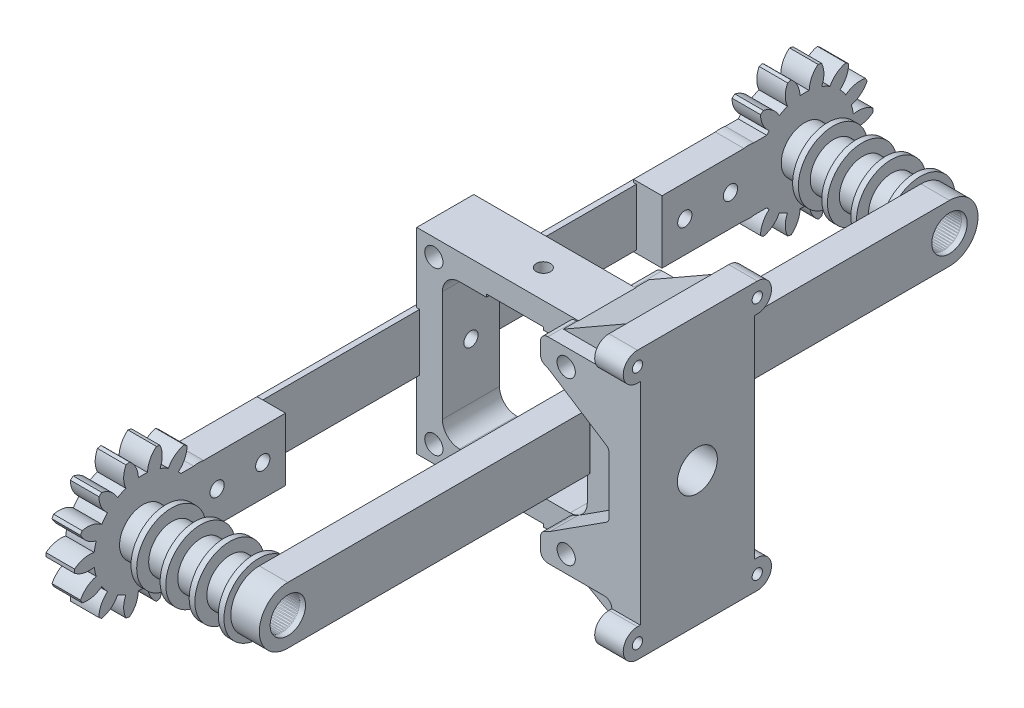
from build123d import *
from build123d.topology import SkipClean

# Parameters (mm, degrees)
BASPROSKE_W              = 5
BASPROSKE_H              = 12
TOOTHCUT_DEPTH           = 18.691806013
TEETHCUTS_COUNT          = 14
TEETHCUTS_ANGLE          = 334.285714286
BORSKE_R                 = 3.1
BORE_DEPTH               = 50.0000508
SKETCH_2_W               = 20
SKETCH_2_H               = 11
EXTRUDE_1_DEPTH          = 5
SKETCH_3_W               = 17
SKETCH_3_H               = 10
CUT_EXTRUDE_1_DEPTH      = 0.5
SKETCH_5_W               = 10
SKETCH_5_H               = 10
SKETCH_5_W_2             = 8
SKETCH_5_H_2             = 8
EXTRUDE_2_DEPTH          = 50
SKETCH_12_W              = 9
SKETCH_12_H              = 10
CUT_EXTRUDE_4_DEPTH      = 73.447820449
CUT_EXTRUDE_2_DEPTH      = 60.436408773
CUT_EXTRUDE_2_DEPTH_BACK = 60.436408773
SKETCH_4_R               = 1.25
SKETCH_7_R               = 4.1
SKETCH_7_R_2             = 3.1
EXTRUDE_3_DEPTH          = 4
PATTERN_LINEAR_1_COUNT   = 5
PATTERN_LINEAR_1_PITCH   = 5.1
SKETCH_14_R              = 3.1
EXTRUDE_5_DEPTH          = 1
SKETCH_15_W              = 34.4
SKETCH_15_H              = 34.4
SKETCH_15_R              = 1.6
EXTRUDE_6_DEPTH          = 5
SKETCH_17_R              = 6.1
SKETCH_17_R_2            = 3.1
EXTRUDE_8_DEPTH          = 1
PATTERN_LINEAR_3_COUNT   = 4
PATTERN_LINEAR_3_PITCH   = 5.1
PATTERN_LINEAR_2_COUNT   = 2
PATTERN_LINEAR_2_PITCH   = 100
MOVE_BODY_2_ANGLE        = 180
MOVE_BODY_2_2_ANGLE      = 180
MOVE_BODY_2_3_ANGLE      = 180
MOVE_BODY_2_4_ANGLE      = 180
MOVE_BODY_2_5_ANGLE      = 180
MOVE_BODY_2_6_ANGLE      = 180
MOVE_BODY_2_7_ANGLE      = 180
MOVE_BODY_2_8_ANGLE      = 180
MOVE_BODY_2_9_ANGLE      = 180
MOVE_BODY_2_10_ANGLE     = 180
MOVE_BODY_2_11_ANGLE     = 180
MOVE_BODY_2_12_ANGLE     = 180
MOVE_BODY_2_13_ANGLE     = 180
CUT_EXTRUDE_5_DEPTH      = 78.959284245
CUT_EXTRUDE_5_DEPTH_BACK = 78.959284245
SKETCH_16_W              = 10
SKETCH_16_H              = 1
SKETCH_16_W_2            = 1
SKETCH_16_H_2            = 10
EXTRUDE_START            = -5
EXTRUDE_7_OUTLINE_W      = 1
EXTRUDE_7_OUTLINE_H      = 10
EXTRUDE_7_DEPTH          = 5
EXTRUDE_7_2_OUTLINE_W    = 1
EXTRUDE_7_2_OUTLINE_H    = 10
EXTRUDE_7_2_DEPTH        = 5
EXTRUDE_7_3_OUTLINE_W    = 10
EXTRUDE_7_3_OUTLINE_H    = 1
EXTRUDE_7_3_DEPTH        = 5
EXTRUDE_7_4_OUTLINE_W    = 10
EXTRUDE_7_4_OUTLINE_H    = 1
EXTRUDE_7_4_DEPTH        = 5
SKETCH_21_R              = 1.25
CUT_EXTRUDE_6_DEPTH      = 134.848048174
SKETCH_22_R              = 1.25
CUT_EXTRUDE_7_DEPTH      = 136.891022514
SKETCH_23_R              = 1.6
CUT_EXTRUDE_8_DEPTH      = 134.848048174
SKETCH_24_R              = 1.6
CUT_EXTRUDE_9_DEPTH      = 136.891022514
SKETCH_25_R              = 1.6
EXTRUDE_9_DEPTH          = 10
EXTRUDE_10_DEPTH         = 5
SKETCH_26_R              = 0.9
SKETCH_26_R_2            = 3.5
CUT_EXTRUDE_10_DEPTH     = 138.504945366
EXTRUDE_11_DEPTH         = 7.5
OTHER_START              = -63.1
OTHER_2_OUTLINE_R        = 1.6
OTHER_2_DEPTH            = 10.2
OTHER_START_2            = -63.2
OTHER_2_2_OUTLINE_R      = 1.5
OTHER_2_2_OUTLINE_R_2    = 1.4
OTHER_2_2_DEPTH          = 10.4
OTHER_2_3_OUTLINE_R      = 1.6
OTHER_2_3_OUTLINE_R_2    = 1.5
OTHER_2_3_DEPTH          = 0.1
OTHER_START_3            = -52.9
OTHER_2_4_OUTLINE_R      = 1.6
OTHER_2_4_OUTLINE_R_2    = 1.5
OTHER_2_4_DEPTH          = 0.1
MOVE_BODY_4_ANGLE        = 180
MOVE_BODY_4_2_ANGLE      = 180
MOVE_BODY_4_3_ANGLE      = 180
MOVE_BODY_4_4_ANGLE      = 180
MOVE_BODY_4_5_ANGLE      = 180
MOVE_BODY_4_6_ANGLE      = 180
MOVE_BODY_4_7_ANGLE      = 180
MOVE_BODY_4_8_ANGLE      = 180
MOVE_BODY_4_9_ANGLE      = 180
MOVE_BODY_4_10_ANGLE     = 180
MOVE_BODY_4_11_ANGLE     = 180
MOVE_BODY_4_12_ANGLE     = 180
MOVE_BODY_4_13_ANGLE     = 180
MOVE_BODY_4_14_ANGLE     = 180
MOVE_BODY_4_15_ANGLE     = 180
MOVE_BODY_4_16_ANGLE     = 180
MOVE_BODY_4_17_ANGLE     = 180
MOVE_BODY_4_18_ANGLE     = 180
MOVE_BODY_4_19_ANGLE     = 180
MOVE_BODY_4_20_ANGLE     = 180
MOVE_BODY_4_21_ANGLE     = 180
MOVE_BODY_4_22_ANGLE     = 180
MOVE_BODY_4_23_ANGLE     = 180
SKETCH_29_R              = 1.5
CUT_EXTRUDE_11_DEPTH     = 10.2
EXTRUDE_START_2          = -4
SKETCH_30_R              = 3.25
SKETCH_30_R_2            = 3.1
EXTRUDE_12_DEPTH         = 4
OTHER_START_4            = 0.95
OTHER_3_OUTLINE_W        = 10
OTHER_3_OUTLINE_H        = 10.3
OTHER_3_OUTLINE_R        = 1.6
OTHER_3_DEPTH            = 0.15
OTHER_START_5            = 0.45
OTHER_3_2_OUTLINE_W      = 0.15
OTHER_3_2_OUTLINE_H      = 10.3
OTHER_3_2_DEPTH          = 0.5


with BuildPart() as part:
    # BasProSke → Base-Revolve (revolve)
    with BuildSketch(Plane(origin=(0, 0, 0), x_dir=(1, 0, 0), z_dir=(0, 1, 0)), mode=Mode.PRIVATE) as base_revolve_sk:
        with Locations((2.5, 6)):
            Rectangle(BASPROSKE_W, BASPROSKE_H)
    revolve(base_revolve_sk.sketch.rotate(Axis((-10, 0, 0), (1, 0, 0)), 180), axis=Axis((-10, 0, 0), (1, 0, 0)))

    # TooCutSke → ToothCut (cut, through all)
    with BuildSketch(Plane(origin=(0, 0, 0), x_dir=(0, 0, -1), z_dir=(1, 0, 0))):
        with BuildLine():
            ThreePointArc((0.804845511, 8.586361261), (0, 8.624), (-0.804845511, 8.586361261))
            ThreePointArc((-0.804845511, 8.586361261), (-1.237812142, 10.362618414), (-2.384428228, 11.78663426))
            ThreePointArc((-2.384428228, 11.78663426), (0, 12.0254), (2.384428228, 11.78663426))
            ThreePointArc((2.384428228, 11.78663426), (1.237812142, 10.362618414), (0.804845511, 8.586361261))
        make_face()
    toothcut = extrude(amount=TOOTHCUT_DEPTH, mode=Mode.SUBTRACT)

    # TeethCuts: ToothCut ×14 about axis
    teethcuts_axis = Axis((-10, 0, 0), (1, 0, 0))
    for i in range(1, TEETHCUTS_COUNT):
        add(toothcut.rotate(teethcuts_axis, i * TEETHCUTS_ANGLE / (TEETHCUTS_COUNT - 1)), mode=Mode.SUBTRACT)

    # BorSke → Bore (cut, symmetric)
    with BuildSketch(Plane(origin=(0, 0, 0), x_dir=(0, 0, -1), z_dir=(1, 0, 0))):
        with Locations(Location((0, 0, 0), (0, 0, 180))):
            Circle(BORSKE_R)
    extrude(amount=BORE_DEPTH, both=True, mode=Mode.SUBTRACT)

    # ｽｹｯﾁ2 → ﾎﾞｽ - 押し出し1 (add)
    with BuildSketch(Plane(origin=(5, 0, 0), x_dir=(0, 0, -1), z_dir=(1, 0, 0))):
        with Locations((15, 0)):
            Rectangle(SKETCH_2_W, SKETCH_2_H)
    extrude(amount=-EXTRUDE_1_DEPTH)

    # ｽｹｯﾁ3 → ｶｯﾄ - 押し出し1 (cut)
    with BuildSketch(Plane(origin=(5, 0, 0), x_dir=(0, 0, -1), z_dir=(1, 0, 0))):
        with Locations((16.5, 0)):
            Rectangle(SKETCH_3_W, SKETCH_3_H)
    extrude(amount=-CUT_EXTRUDE_1_DEPTH, mode=Mode.SUBTRACT)

    # ｽｹｯﾁ4 → ｶｯﾄ - 押し出し2 (cut, two sides: drawn at the far end of the back side and taken through both)
    with BuildSketch(Plane.ZY.offset(-CUT_EXTRUDE_2_DEPTH_BACK)):
        with Locations(Location((-21, 0, 0), (0, 0, 180))):
            Circle(SKETCH_4_R)
        with Locations(Location((-13, 0, 0), (0, 0, 180))):
            Circle(SKETCH_4_R)
    extrude(amount=CUT_EXTRUDE_2_DEPTH + CUT_EXTRUDE_2_DEPTH_BACK, mode=Mode.SUBTRACT)


with BuildPart() as body_2:
    # ｽｹｯﾁ5 → ﾎﾞｽ - 押し出し2 (new body)
    with BuildSketch(Plane(origin=(0, 0, -8), x_dir=(-1, 0, 0), z_dir=(0, 0, -1))):
        with Locations((-9.5, 0)):
            Rectangle(SKETCH_5_W, SKETCH_5_H)
        with Locations((-9.5, 0)):
            Rectangle(SKETCH_5_W_2, SKETCH_5_H_2, mode=Mode.SUBTRACT)
    extrude(amount=EXTRUDE_2_DEPTH)

    # ｽｹｯﾁ12 → ｶｯﾄ - 押し出し4 (cut, through all)
    with BuildSketch(Plane(origin=(0, 0, -58), x_dir=(-1, 0, 0), z_dir=(0, 0, -1))):
        with Locations((-10, 0)):
            Rectangle(SKETCH_12_W, SKETCH_12_H)
    extrude(amount=-CUT_EXTRUDE_4_DEPTH, mode=Mode.SUBTRACT)


with BuildPart() as body_3:
    # ｽｹｯﾁ7 → ﾎﾞｽ - 押し出し3 (new body)
    with BuildSketch(Plane.ZY):
        Circle(SKETCH_7_R)
        Circle(SKETCH_7_R_2, mode=Mode.SUBTRACT)
    extrude(amount=EXTRUDE_3_DEPTH)


with BuildPart() as pattern_linear_1_1:
    # 直線ﾊﾟﾀｰﾝ1: pattern copy
    add(body_3.part.moved(Location(Vector(-1, 0, 0) * (1 * PATTERN_LINEAR_1_PITCH))))


with BuildPart() as pattern_linear_1_2:
    # 直線ﾊﾟﾀｰﾝ1: pattern copy
    add(body_3.part.moved(Location(Vector(-1, 0, 0) * (2 * PATTERN_LINEAR_1_PITCH))))


with BuildPart() as pattern_linear_1_3:
    # 直線ﾊﾟﾀｰﾝ1: pattern copy
    add(body_3.part.moved(Location(Vector(-1, 0, 0) * (3 * PATTERN_LINEAR_1_PITCH))))


with BuildPart() as pattern_linear_1_4:
    # 直線ﾊﾟﾀｰﾝ1: pattern copy
    add(body_3.part.moved(Location(Vector(-1, 0, 0) * (4 * PATTERN_LINEAR_1_PITCH))))


with BuildPart() as body_8:
    # ｽｹｯﾁ14 → ﾎﾞｽ - 押し出し5 (new body)
    with BuildSketch(Plane.ZY.offset(24.4)):
        with BuildLine():
            Line((-58, 5), (0, 5))
            ThreePointArc((0, 5), (5, 0), (0, -5))
            Line((0, -5), (-58, -5))
            Line((-58, -5), (-58, 5))
        make_face()
        Circle(SKETCH_14_R, mode=Mode.SUBTRACT)
    extrude(amount=EXTRUDE_5_DEPTH)


with BuildPart() as body_9:
    # ｽｹｯﾁ15 → ﾎﾞｽ - 押し出し6 (new body)
    with BuildSketch(Plane(origin=(0, 0, -58), x_dir=(-1, 0, 0), z_dir=(0, 0, -1))):
        with Locations((12.2, 0)):
            Rectangle(SKETCH_15_W, SKETCH_15_H)
        with Locations(Location((26.4, 14.2, 0), (0, 0, 90))):
            Circle(SKETCH_15_R, mode=Mode.SUBTRACT)
        with Locations(Location((26.4, -14.2, 0), (0, 0, 90))):
            Circle(SKETCH_15_R, mode=Mode.SUBTRACT)
        with Locations(Location((-2, -14.2, 0), (0, 0, 90))):
            Circle(SKETCH_15_R, mode=Mode.SUBTRACT)
        with Locations(Location((-2, 14.2, 0), (0, 0, 90))):
            Circle(SKETCH_15_R, mode=Mode.SUBTRACT)
        with BuildLine():
            Line((21.9, -12.7), (2.5, -12.7))
            ThreePointArc((2.5, -12.7), (0.378679656, -11.821320344), (-0.5, -9.7))
            Line((-0.5, -9.7), (-0.5, 9.7))
            ThreePointArc((-0.5, 9.7), (0.378679656, 11.821320344), (2.5, 12.7))
            Line((2.5, 12.7), (21.9, 12.7))
            ThreePointArc((21.9, 12.7), (24.021320344, 11.821320344), (24.9, 9.7))
            Line((24.9, 9.7), (24.9, -9.7))
            ThreePointArc((24.9, -9.7), (24.021320344, -11.821320344), (21.9, -12.7))
        make_face(mode=Mode.SUBTRACT)
    extrude(amount=-EXTRUDE_6_DEPTH)


with BuildPart() as body_10:
    # ｽｹｯﾁ17 → ﾎﾞｽ - 押し出し8 (new body)
    with BuildSketch(Plane.ZY.offset(4)):
        Circle(SKETCH_17_R)
        Circle(SKETCH_17_R_2, mode=Mode.SUBTRACT)
    extrude(amount=EXTRUDE_8_DEPTH)


with BuildPart() as pattern_linear_3_1:
    # 直線ﾊﾟﾀｰﾝ3: pattern copy
    add(body_10.part.moved(Location(Vector(-1, 0, 0) * (1 * PATTERN_LINEAR_3_PITCH))))


with BuildPart() as pattern_linear_3_2:
    # 直線ﾊﾟﾀｰﾝ3: pattern copy
    add(body_10.part.moved(Location(Vector(-1, 0, 0) * (2 * PATTERN_LINEAR_3_PITCH))))


with BuildPart() as pattern_linear_3_3:
    # 直線ﾊﾟﾀｰﾝ3: pattern copy
    add(body_10.part.moved(Location(Vector(-1, 0, 0) * (3 * PATTERN_LINEAR_3_PITCH))))


with BuildPart() as pattern_linear_2_1:
    # 直線ﾊﾟﾀｰﾝ2: pattern copy
    add(body_10.part.moved(Location(Vector(0, 0, -1) * (1 * PATTERN_LINEAR_2_PITCH))))


with BuildPart() as pattern_linear_2_2:
    # 直線ﾊﾟﾀｰﾝ2: pattern copy
    add(pattern_linear_3_1.part.moved(Location(Vector(0, 0, -1) * (1 * PATTERN_LINEAR_2_PITCH))))


with BuildPart() as pattern_linear_2_3:
    # 直線ﾊﾟﾀｰﾝ2: pattern copy
    add(pattern_linear_3_2.part.moved(Location(Vector(0, 0, -1) * (1 * PATTERN_LINEAR_2_PITCH))))


with BuildPart() as pattern_linear_2_4:
    # 直線ﾊﾟﾀｰﾝ2: pattern copy
    add(pattern_linear_3_3.part.moved(Location(Vector(0, 0, -1) * (1 * PATTERN_LINEAR_2_PITCH))))


with BuildPart() as pattern_linear_2_5:
    # 直線ﾊﾟﾀｰﾝ2: pattern copy
    add(body_3.part.moved(Location(Vector(0, 0, -1) * (1 * PATTERN_LINEAR_2_PITCH))))


with BuildPart() as pattern_linear_2_6:
    # 直線ﾊﾟﾀｰﾝ2: pattern copy
    add(pattern_linear_1_1.part.moved(Location(Vector(0, 0, -1) * (1 * PATTERN_LINEAR_2_PITCH))))


with BuildPart() as pattern_linear_2_7:
    # 直線ﾊﾟﾀｰﾝ2: pattern copy
    add(body_9.part.moved(Location(Vector(0, 0, -1) * (1 * PATTERN_LINEAR_2_PITCH))))


with BuildPart() as pattern_linear_2_8:
    # 直線ﾊﾟﾀｰﾝ2: pattern copy
    add(pattern_linear_1_2.part.moved(Location(Vector(0, 0, -1) * (1 * PATTERN_LINEAR_2_PITCH))))


with BuildPart() as pattern_linear_2_9:
    # 直線ﾊﾟﾀｰﾝ2: pattern copy
    add(pattern_linear_1_3.part.moved(Location(Vector(0, 0, -1) * (1 * PATTERN_LINEAR_2_PITCH))))


with BuildPart() as pattern_linear_2_10:
    # 直線ﾊﾟﾀｰﾝ2: pattern copy
    add(body_2.part.moved(Location(Vector(0, 0, -1) * (1 * PATTERN_LINEAR_2_PITCH))))


with BuildPart() as pattern_linear_2_11:
    # 直線ﾊﾟﾀｰﾝ2: pattern copy
    add(part.part.moved(Location(Vector(0, 0, -1) * (1 * PATTERN_LINEAR_2_PITCH))))


with BuildPart() as pattern_linear_2_12:
    # 直線ﾊﾟﾀｰﾝ2: pattern copy
    add(pattern_linear_1_4.part.moved(Location(Vector(0, 0, -1) * (1 * PATTERN_LINEAR_2_PITCH))))


with BuildPart() as pattern_linear_2_13:
    # 直線ﾊﾟﾀｰﾝ2: pattern copy
    add(body_8.part.moved(Location(Vector(0, 0, -1) * (1 * PATTERN_LINEAR_2_PITCH))))


with BuildPart() as pattern_linear_2_2_1:
    # Move Body 2: read off the stored shape, not the designer's step
    # Move Body 2: moved
    add(pattern_linear_2_2.part.moved(Location((12.2, 12.2, 216))).rotate(Axis((0, 0, 0), (0.7071067812, -0.7071067812, 0)), MOVE_BODY_2_ANGLE))


with BuildPart() as pattern_linear_2_12_1:
    # Move Body 2 2: moved
    add(pattern_linear_2_12.part.moved(Location((12.2, 12.2, 216))).rotate(Axis((0, 0, 0), (0.7071067812, -0.7071067812, 0)), MOVE_BODY_2_2_ANGLE))


with BuildPart() as pattern_linear_2_9_1:
    # Move Body 2 3: moved
    add(pattern_linear_2_9.part.moved(Location((12.2, 12.2, 216))).rotate(Axis((0, 0, 0), (0.7071067812, -0.7071067812, 0)), MOVE_BODY_2_3_ANGLE))


with BuildPart() as pattern_linear_2_11_1:
    # Move Body 2 4: moved
    add(pattern_linear_2_11.part.moved(Location((12.2, 12.2, 216))).rotate(Axis((0, 0, 0), (0.7071067812, -0.7071067812, 0)), MOVE_BODY_2_4_ANGLE))


with BuildPart() as pattern_linear_2_3_1:
    # Move Body 2 5: moved
    add(pattern_linear_2_3.part.moved(Location((12.2, 12.2, 216))).rotate(Axis((0, 0, 0), (0.7071067812, -0.7071067812, 0)), MOVE_BODY_2_5_ANGLE))


with BuildPart() as pattern_linear_2_4_1:
    # Move Body 2 6: moved
    add(pattern_linear_2_4.part.moved(Location((12.2, 12.2, 216))).rotate(Axis((0, 0, 0), (0.7071067812, -0.7071067812, 0)), MOVE_BODY_2_6_ANGLE))


with BuildPart() as pattern_linear_2_5_1:
    # Move Body 2 7: moved
    add(pattern_linear_2_5.part.moved(Location((12.2, 12.2, 216))).rotate(Axis((0, 0, 0), (0.7071067812, -0.7071067812, 0)), MOVE_BODY_2_7_ANGLE))


with BuildPart() as pattern_linear_2_8_1:
    # Move Body 2 8: moved
    add(pattern_linear_2_8.part.moved(Location((12.2, 12.2, 216))).rotate(Axis((0, 0, 0), (0.7071067812, -0.7071067812, 0)), MOVE_BODY_2_8_ANGLE))


with BuildPart() as pattern_linear_2_6_1:
    # Move Body 2 9: moved
    add(pattern_linear_2_6.part.moved(Location((12.2, 12.2, 216))).rotate(Axis((0, 0, 0), (0.7071067812, -0.7071067812, 0)), MOVE_BODY_2_9_ANGLE))


with BuildPart() as pattern_linear_2_1_1:
    # Move Body 2 10: moved
    add(pattern_linear_2_1.part.moved(Location((12.2, 12.2, 216))).rotate(Axis((0, 0, 0), (0.7071067812, -0.7071067812, 0)), MOVE_BODY_2_10_ANGLE))


with BuildPart() as pattern_linear_2_13_1:
    # Move Body 2 11: moved
    add(pattern_linear_2_13.part.moved(Location((12.2, 12.2, 216))).rotate(Axis((0, 0, 0), (0.7071067812, -0.7071067812, 0)), MOVE_BODY_2_11_ANGLE))

    # Extrude 7 3 outline → Extrude 7 3 (add)
    with BuildSketch(Plane.XY.offset(-58)):
        with Locations((-12.2, 12.7)):
            Rectangle(EXTRUDE_7_3_OUTLINE_W, EXTRUDE_7_3_OUTLINE_H)
    extrude(amount=EXTRUDE_7_3_DEPTH)


with BuildPart() as pattern_linear_2_10_1:
    # Move Body 2 12: moved
    add(pattern_linear_2_10.part.moved(Location((12.2, 12.2, 216))).rotate(Axis((0, 0, 0), (0.7071067812, -0.7071067812, 0)), MOVE_BODY_2_12_ANGLE))

    # Extrude 7 4 outline → Extrude 7 4 (add)
    with BuildSketch(Plane.XY.offset(-58)):
        with Locations((-12.2, -17.2)):
            Rectangle(EXTRUDE_7_4_OUTLINE_W, EXTRUDE_7_4_OUTLINE_H)
    extrude(amount=EXTRUDE_7_4_DEPTH)


with BuildPart() as pattern_linear_2_7_1:
    # Move Body 2 13: moved
    add(pattern_linear_2_7.part.moved(Location((12.2, 12.2, 216))).rotate(Axis((0, 0, 0), (0.7071067812, -0.7071067812, 0)), MOVE_BODY_2_13_ANGLE))


with BuildPart() as cut_extrude_5_tool:
    # ｽｹｯﾁ16 → ｶｯﾄ - 押し出し5 (new, two sides: drawn at the far end of the back side and taken through both)
    with BuildSketch(Plane.XY.offset(-58).offset(-CUT_EXTRUDE_5_DEPTH_BACK)):
        with Locations((-12.2, -17.2)):
            Rectangle(SKETCH_16_W, SKETCH_16_H)
        with Locations((5, 0)):
            Rectangle(SKETCH_16_W_2, SKETCH_16_H_2)
        with Locations((-12.2, 12.7)):
            Rectangle(SKETCH_16_W, SKETCH_16_H)
        with Locations((-24.9, 0)):
            Rectangle(SKETCH_16_W_2, SKETCH_16_H_2)
    extrude(amount=CUT_EXTRUDE_5_DEPTH + CUT_EXTRUDE_5_DEPTH_BACK)


with BuildPart() as body_9_1:
    add(body_9.part)

    # ｶｯﾄ - 押し出し5: cut by cut_extrude_5_tool
    add(cut_extrude_5_tool.part, mode=Mode.SUBTRACT)


with BuildPart() as pattern_linear_2_7_2:
    add(pattern_linear_2_7_1.part)

    # ｶｯﾄ - 押し出し5: cut by cut_extrude_5_tool
    add(cut_extrude_5_tool.part, mode=Mode.SUBTRACT)


with BuildPart() as body_9_2:
    add(body_9_1.part)

    # Combine 1: union 直線ﾊﾟﾀｰﾝ2_7
    add(pattern_linear_2_7_2.part)

    # ｽｹｯﾁ21 → ｶｯﾄ - 押し出し6 (cut, through all)
    with SkipClean():  # the faces are left unmerged after this step: merging them gives an invalid solid
        with BuildSketch(Plane.ZY.offset(29.4)):
            with Locations((-58, 0)):
                Circle(SKETCH_21_R)
        extrude(amount=-CUT_EXTRUDE_6_DEPTH, mode=Mode.SUBTRACT)

    # ｽｹｯﾁ22 → ｶｯﾄ - 押し出し7 (cut, through all)
    with SkipClean():  # the faces are left unmerged after this step: merging them gives an invalid solid
        with BuildSketch(Plane.XZ.offset(17.7)):
            with Locations(Location((-12.2, -58, 0), (0, 0, 270))):
                Circle(SKETCH_22_R)
        extrude(amount=-CUT_EXTRUDE_7_DEPTH, mode=Mode.SUBTRACT)


with BuildPart() as body_8_1:
    add(body_8.part)

    # ﾎﾞｽ - 押し出し7: read off the stored shape, not the designer's step
    # ﾎﾞｽ - 押し出し7 outline → ﾎﾞｽ - 押し出し7 (add)
    with BuildSketch(Plane.XY.offset(-58).offset(EXTRUDE_START)):
        with Locations((-24.9, 0)):
            Rectangle(EXTRUDE_7_OUTLINE_W, EXTRUDE_7_OUTLINE_H)
    extrude(amount=EXTRUDE_7_DEPTH)


with BuildPart() as body_2_1:
    add(body_2.part)

    # Extrude 7 2 outline → Extrude 7 2 (add)
    with BuildSketch(Plane.XY.offset(-58).offset(EXTRUDE_START)):
        with Locations((5, 0)):
            Rectangle(EXTRUDE_7_2_OUTLINE_W, EXTRUDE_7_2_OUTLINE_H)
    extrude(amount=EXTRUDE_7_2_DEPTH)


with BuildPart() as cut_extrude_8_tool:
    # ｽｹｯﾁ23 → ｶｯﾄ - 押し出し8 (new, through all)
    with BuildSketch(Plane.ZY.offset(29.4)):
        with Locations(Location((-58, 0, 0), (0, 0, 180))):
            Circle(SKETCH_23_R)
    extrude(amount=-CUT_EXTRUDE_8_DEPTH)


with BuildPart() as body_2_2:
    add(body_2_1.part)

    # ｶｯﾄ - 押し出し8: cut by cut_extrude_8_tool
    add(cut_extrude_8_tool.part, mode=Mode.SUBTRACT)


with BuildPart() as body_8_2:
    add(body_8_1.part)

    # ｶｯﾄ - 押し出し8: cut by cut_extrude_8_tool
    add(cut_extrude_8_tool.part, mode=Mode.SUBTRACT)


with BuildPart() as cut_extrude_9_tool:
    # ｽｹｯﾁ24 → ｶｯﾄ - 押し出し9 (new, through all)
    with BuildSketch(Plane(origin=(0, 17.2, 0), x_dir=(1, 0, 0), z_dir=(0, 1, 0))):
        with Locations((-12.2, 58)):
            Circle(SKETCH_24_R)
    extrude(amount=-CUT_EXTRUDE_9_DEPTH)


with BuildPart() as pattern_linear_2_13_2:
    add(pattern_linear_2_13_1.part)

    # ｶｯﾄ - 押し出し9: cut by cut_extrude_9_tool
    add(cut_extrude_9_tool.part, mode=Mode.SUBTRACT)


with BuildPart() as pattern_linear_2_10_2:
    add(pattern_linear_2_10_1.part)

    # ｶｯﾄ - 押し出し9: cut by cut_extrude_9_tool
    add(cut_extrude_9_tool.part, mode=Mode.SUBTRACT)


with BuildPart() as body_14:
    # ﾐﾗｰ3: mirrored copy
    add(pattern_linear_1_3.part.mirror(Plane.XY.offset(-58)))


with BuildPart() as body_15:
    # Mirror 3 2: mirrored copy
    add(pattern_linear_3_3.part.mirror(Plane.XY.offset(-58)))


with BuildPart() as body_16:
    # Mirror 3 3: mirrored copy
    add(pattern_linear_1_2.part.mirror(Plane.XY.offset(-58)))


with BuildPart() as body_17:
    # Mirror 3 4: mirrored copy
    add(body_10.part.mirror(Plane.XY.offset(-58)))


with BuildPart() as body_18:
    # Mirror 3 5: mirrored copy
    add(part.part.mirror(Plane.XY.offset(-58)))


with BuildPart() as body_19:
    # Mirror 3 6: mirrored copy
    add(pattern_linear_3_2.part.mirror(Plane.XY.offset(-58)))


with BuildPart() as body_20:
    # Mirror 3 7: mirrored copy
    add(pattern_linear_1_1.part.mirror(Plane.XY.offset(-58)))


with BuildPart() as body_21:
    # Mirror 3 8: mirrored copy
    add(pattern_linear_1_4.part.mirror(Plane.XY.offset(-58)))


with BuildPart() as body_22:
    # Mirror 3 9: mirrored copy
    add(pattern_linear_3_1.part.mirror(Plane.XY.offset(-58)))


with BuildPart() as body_23:
    # Mirror 3 10: mirrored copy
    add(body_3.part.mirror(Plane.XY.offset(-58)))


with BuildPart() as body_24:
    # Mirror 3 11: mirrored copy
    add(body_8_2.part.mirror(Plane.XY.offset(-58)))


with BuildPart() as body_25:
    # Mirror 3 12: mirrored copy
    add(body_2_2.part.mirror(Plane.XY.offset(-58)))


with BuildPart() as body_2_3:
    add(body_2_2.part)

    # Combine 2: union body 25
    add(body_25.part)


with BuildPart() as body_8_3:
    add(body_8_2.part)

    # Combine 3: union body 24
    add(body_24.part)


with BuildPart() as body_24_2:
    # ｽｹｯﾁ25 → ﾎﾞｽ - 押し出し9 (new, symmetric)
    with BuildSketch(Plane.XY.offset(-58)):
        with BuildLine():
            Line((-2.5, 13.798780306), (-2.5, 15.9))
            ThreePointArc((-2.5, 15.9), (-2.119238816, 16.819238816), (-1.2, 17.2))
            Line((-1.2, 17.2), (8.7, 17.2))
            ThreePointArc((8.7, 17.2), (9.619238816, 17.580761184), (10, 18.5))
            Line((10, 18.5), (10, 23.5))
            Line((10, 23.5), (15, 23.5))
            Line((15, 23.5), (15, -23.5))
            Line((15, -23.5), (10, -23.5))
            Line((10, -23.5), (10, -18.5))
            ThreePointArc((10, -18.5), (9.619238816, -17.580761184), (8.7, -17.2))
            Line((8.7, -17.2), (-1.2, -17.2))
            ThreePointArc((-1.2, -17.2), (-2.119238816, -16.819238816), (-2.5, -15.9))
            Line((-2.5, -15.9), (-2.5, -13.798780306))
            ThreePointArc((-2.5, -13.798780306), (-2.24903056, -13.030968556), (-1.593023256, -12.559614167))
            ThreePointArc((-1.593023256, -12.559614167), (-1.223660664, -12.41495081), (-0.876613619, -12.222819189))
            Line((-0.876613619, -12.222819189), (9.041128794, -5.84093973))
            ThreePointArc((9.041128794, -5.84093973), (9.377817975, -5.478994367), (9.5, -5))
            Line((9.5, -5), (9.5, 5))
            ThreePointArc((9.5, 5), (9.377817975, 5.478994367), (9.041128794, 5.84093973))
            Line((9.041128794, 5.84093973), (-0.876613619, 12.222819189))
            ThreePointArc((-0.876613619, 12.222819189), (-1.223660664, 12.41495081), (-1.593023256, 12.559614167))
            ThreePointArc((-1.593023256, 12.559614167), (-2.24903056, 13.030968556), (-2.5, 13.798780306))
        make_face()
        with Locations((2, 14.2)):
            Circle(SKETCH_25_R, mode=Mode.SUBTRACT)
        with Locations((2, -14.2)):
            Circle(SKETCH_25_R, mode=Mode.SUBTRACT)
    extrude(amount=EXTRUDE_9_DEPTH, both=True)

    # ｽｹｯﾁ27 → ﾎﾞｽ - 押し出し10 (add)
    with BuildSketch(Plane(origin=(15, 0, 0), x_dir=(0, 0, -1), z_dir=(1, 0, 0))):
        with BuildLine():
            Line((47.5, 23.5), (68.5, 23.5))
            ThreePointArc((68.5, 23.5), (71, 21), (68.5, 18.5))
            Line((68.5, 18.5), (47.5, 18.5))
            ThreePointArc((47.5, 18.5), (45, 21), (47.5, 23.5))
        make_face()
        with BuildLine():
            Line((47.5, -23.5), (68.5, -23.5))
            ThreePointArc((68.5, -23.5), (71, -21), (68.5, -18.5))
            Line((68.5, -18.5), (47.5, -18.5))
            ThreePointArc((47.5, -18.5), (45, -21), (47.5, -23.5))
        make_face()
    extrude(amount=-EXTRUDE_10_DEPTH)

    # ｽｹｯﾁ26 → ｶｯﾄ - 押し出し10 (cut, through all)
    with BuildSketch(Plane(origin=(15, 0, 0), x_dir=(0, 0, -1), z_dir=(1, 0, 0))):
        with Locations(Location((47.5, 21, 0), (0, 0, 90))):
            Circle(SKETCH_26_R)
        with Locations(Location((68.5, 21, 0), (0, 0, 90))):
            Circle(SKETCH_26_R)
        with Locations(Location((68.5, -21, 0), (0, 0, 90))):
            Circle(SKETCH_26_R)
        with Locations(Location((47.5, -21, 0), (0, 0, 90))):
            Circle(SKETCH_26_R)
        with Locations(Location((58, 0, 0), (0, 0, 90))):
            Circle(SKETCH_26_R_2)
    extrude(amount=-CUT_EXTRUDE_10_DEPTH, mode=Mode.SUBTRACT)

    # ｽｹｯﾁ28 → ﾎﾞｽ - 押し出し11 (add, symmetric)
    with BuildSketch(Plane.XY.offset(-58)):
        Polygon((10, -17.2), (10, -23.5), (-1, -17.2), align=None)
        Polygon((10, 17.2), (10, 23.5), (-1, 17.2), align=None)
    extrude(amount=EXTRUDE_11_DEPTH, both=True)

    # ｲﾝﾃﾞﾝﾄ2: read off the stored shape, not the designer's step
    # ｲﾝﾃﾞﾝﾄ2 outline → ｲﾝﾃﾞﾝﾄ2 (cut)
    # profile 1 of 2: a face of its own
    with BuildSketch(Plane.XY.offset(OTHER_START)):
        with BuildLine():
            Line((-1, -17.2), (-0.825396825, -17.3))
            Line((-0.825396825, -17.3), (5.1, -17.3))
            Line((5.1, -17.3), (5.1, -8.376981487))
            Line((5.1, -8.376981487), (-0.876613619, -12.222819189))
            ThreePointArc((-0.876613619, -12.222819189), (-1.223660664, -12.41495081), (-1.593023256, -12.559614167))
            ThreePointArc((-1.593023256, -12.559614167), (-2.24903056, -13.030968556), (-2.5, -13.798780306))
            Line((-2.5, -13.798780306), (-2.5, -15.9))
            ThreePointArc((-2.5, -15.9), (-2.119238816, -16.819238816), (-1.2, -17.2))
            Line((-1.2, -17.2), (-1, -17.2))
        make_face()
        with Locations((2, -14.2)):
            Circle(OTHER_2_OUTLINE_R, mode=Mode.SUBTRACT)
    # profile 2 of 2: a face of its own
    with BuildSketch(Plane.XY.offset(OTHER_START)):
        with BuildLine():
            Line((-0.876613619, 12.222819189), (5.1, 8.376981487))
            Line((5.1, 8.376981487), (5.1, 17.3))
            Line((5.1, 17.3), (-0.825396825, 17.3))
            Line((-0.825396825, 17.3), (-1, 17.2))
            Line((-1, 17.2), (-1.2, 17.2))
            ThreePointArc((-1.2, 17.2), (-2.119238816, 16.819238816), (-2.5, 15.9))
            Line((-2.5, 15.9), (-2.5, 13.798780306))
            ThreePointArc((-2.5, 13.798780306), (-2.24903056, 13.030968556), (-1.593023256, 12.559614167))
            ThreePointArc((-1.593023256, 12.559614167), (-1.223660664, 12.41495081), (-0.876613619, 12.222819189))
        make_face()
        with Locations((2, 14.2)):
            Circle(OTHER_2_OUTLINE_R, mode=Mode.SUBTRACT)
    extrude(amount=OTHER_2_DEPTH, mode=Mode.SUBTRACT)

    # Other 2 2 outline → Other 2 2 (add)
    # profile 1 of 2: a face of its own
    with BuildSketch(Plane.XY.offset(OTHER_START_2)):
        with Locations((2, -14.2)):
            Circle(OTHER_2_2_OUTLINE_R)
        with Locations((2, -14.2)):
            Circle(OTHER_2_2_OUTLINE_R_2, mode=Mode.SUBTRACT)
    # profile 2 of 2: a face of its own
    with BuildSketch(Plane.XY.offset(OTHER_START_2)):
        with Locations((2, 14.2)):
            Circle(OTHER_2_2_OUTLINE_R)
        with Locations((2, 14.2)):
            Circle(OTHER_2_2_OUTLINE_R_2, mode=Mode.SUBTRACT)
    extrude(amount=OTHER_2_2_DEPTH)

    # Other 2 3 outline → Other 2 3 (add)
    # profile 1 of 2: a face of its own
    with BuildSketch(Plane.XY.offset(OTHER_START_2)):
        with Locations((2, 14.2)):
            Circle(OTHER_2_3_OUTLINE_R)
        with Locations((2, 14.2)):
            Circle(OTHER_2_3_OUTLINE_R_2, mode=Mode.SUBTRACT)
    # profile 2 of 2: a face of its own
    with BuildSketch(Plane.XY.offset(OTHER_START_2)):
        with Locations((2, -14.2)):
            Circle(OTHER_2_3_OUTLINE_R)
        with Locations((2, -14.2)):
            Circle(OTHER_2_3_OUTLINE_R_2, mode=Mode.SUBTRACT)
    extrude(amount=OTHER_2_3_DEPTH)

    # Other 2 4 outline → Other 2 4 (add)
    # profile 1 of 2: a face of its own
    with BuildSketch(Plane.XY.offset(OTHER_START_3)):
        with Locations((2, 14.2)):
            Circle(OTHER_2_4_OUTLINE_R)
        with Locations((2, 14.2)):
            Circle(OTHER_2_4_OUTLINE_R_2, mode=Mode.SUBTRACT)
    # profile 2 of 2: a face of its own
    with BuildSketch(Plane.XY.offset(OTHER_START_3)):
        with Locations((2, -14.2)):
            Circle(OTHER_2_4_OUTLINE_R)
        with Locations((2, -14.2)):
            Circle(OTHER_2_4_OUTLINE_R_2, mode=Mode.SUBTRACT)
    extrude(amount=OTHER_2_4_DEPTH)

    # ｽｹｯﾁ29 → ｶｯﾄ - 押し出し11 (cut)
    with BuildSketch(Plane.XY.offset(-63.1)):
        with Locations((2, 14.2)):
            Circle(SKETCH_29_R)
        with Locations((2, -14.2)):
            Circle(SKETCH_29_R)
    extrude(amount=CUT_EXTRUDE_11_DEPTH, mode=Mode.SUBTRACT)


with BuildPart() as body_8_4:
    # Move Body 4: read off the stored shape, not the designer's step
    # Move Body 4: moved
    add(body_8_3.part.moved(Location((24.3, 0, 116.1))).rotate(Axis((0, 0, 0), (0, 1, 0)), MOVE_BODY_4_ANGLE))

    # ｽｹｯﾁ30 → ﾎﾞｽ - 押し出し12 (add)
    with BuildSketch(Plane(origin=(0.1, 0, 0), x_dir=(0, 0, -1), z_dir=(1, 0, 0)).offset(EXTRUDE_START_2)):
        with BuildLine():
            Line((116.1, 5), (0.1, 5))
            ThreePointArc((0.1, 5), (-4.9, 0), (0.1, -5))
            Line((0.1, -5), (116.1, -5))
            ThreePointArc((116.1, -5), (121.1, 0), (116.1, 5))
        make_face()
        with Locations(Location((58.1, 0, 0), (0, 0, 90))):
            Circle(SKETCH_30_R, mode=Mode.SUBTRACT)
        with Locations(Location((0.1, 0, 0), (0, 0, 90))):
            Circle(SKETCH_30_R_2, mode=Mode.SUBTRACT)
        with Locations(Location((116.1, 0, 0), (0, 0, 90))):
            Circle(SKETCH_30_R_2, mode=Mode.SUBTRACT)
    extrude(amount=EXTRUDE_12_DEPTH)

    # Other 3: read off the stored shape, not the designer's step
    # Other 3 outline → Other 3 (cut)
    with BuildSketch(Plane.YZ.offset(OTHER_START_4)):
        with Locations((0, -58.1)):
            Rectangle(OTHER_3_OUTLINE_W, OTHER_3_OUTLINE_H)
        with Locations((0, -58.1)):
            Circle(OTHER_3_OUTLINE_R, mode=Mode.SUBTRACT)
    extrude(amount=OTHER_3_DEPTH, mode=Mode.SUBTRACT)

    # Other 3 2 outline → Other 3 2 (cut)
    with BuildSketch(Plane.YZ.offset(OTHER_START_5)):
        with Locations((-4.925, -58.1)):
            Rectangle(OTHER_3_2_OUTLINE_W, OTHER_3_2_OUTLINE_H)
        with Locations((4.925, -58.1)):
            Rectangle(OTHER_3_2_OUTLINE_W, OTHER_3_2_OUTLINE_H)
    extrude(amount=OTHER_3_2_DEPTH, mode=Mode.SUBTRACT)


with BuildPart() as body_2_4:
    # Move Body 4 2: moved
    add(body_2_3.part.moved(Location((24.3, 0, 116.1))).rotate(Axis((0, 0, 0), (0, 1, 0)), MOVE_BODY_4_2_ANGLE))


with BuildPart() as body_23_1:
    # Move Body 4 3: moved
    add(body_23.part.moved(Location((24.3, 0, 116.1))).rotate(Axis((0, 0, 0), (0, 1, 0)), MOVE_BODY_4_3_ANGLE))


with BuildPart() as body_22_1:
    # Move Body 4 4: moved
    add(body_22.part.moved(Location((24.3, 0, 116.1))).rotate(Axis((0, 0, 0), (0, 1, 0)), MOVE_BODY_4_4_ANGLE))


with BuildPart() as body_21_1:
    # Move Body 4 5: moved
    add(body_21.part.moved(Location((24.3, 0, 116.1))).rotate(Axis((0, 0, 0), (0, 1, 0)), MOVE_BODY_4_5_ANGLE))


with BuildPart() as body_20_1:
    # Move Body 4 6: moved
    add(body_20.part.moved(Location((24.3, 0, 116.1))).rotate(Axis((0, 0, 0), (0, 1, 0)), MOVE_BODY_4_6_ANGLE))


with BuildPart() as body_19_1:
    # Move Body 4 7: moved
    add(body_19.part.moved(Location((24.3, 0, 116.1))).rotate(Axis((0, 0, 0), (0, 1, 0)), MOVE_BODY_4_7_ANGLE))


with BuildPart() as body_18_1:
    # Move Body 4 8: moved
    add(body_18.part.moved(Location((24.3, 0, 116.1))).rotate(Axis((0, 0, 0), (0, 1, 0)), MOVE_BODY_4_8_ANGLE))


with BuildPart() as body_17_1:
    # Move Body 4 9: moved
    add(body_17.part.moved(Location((24.3, 0, 116.1))).rotate(Axis((0, 0, 0), (0, 1, 0)), MOVE_BODY_4_9_ANGLE))


with BuildPart() as body_16_1:
    # Move Body 4 10: moved
    add(body_16.part.moved(Location((24.3, 0, 116.1))).rotate(Axis((0, 0, 0), (0, 1, 0)), MOVE_BODY_4_10_ANGLE))


with BuildPart() as body_15_1:
    # Move Body 4 11: moved
    add(body_15.part.moved(Location((24.3, 0, 116.1))).rotate(Axis((0, 0, 0), (0, 1, 0)), MOVE_BODY_4_11_ANGLE))


with BuildPart() as body_14_1:
    # Move Body 4 12: moved
    add(body_14.part.moved(Location((24.3, 0, 116.1))).rotate(Axis((0, 0, 0), (0, 1, 0)), MOVE_BODY_4_12_ANGLE))


with BuildPart() as body_9_3:
    # Move Body 4 13: moved
    add(body_9_2.part.moved(Location((24.3, 0, 116.1))).rotate(Axis((0, 0, 0), (0, 1, 0)), MOVE_BODY_4_13_ANGLE))


with BuildPart() as pattern_linear_3_3_1:
    # Move Body 4 14: moved
    add(pattern_linear_3_3.part.moved(Location((24.3, 0, 116.1))).rotate(Axis((0, 0, 0), (0, 1, 0)), MOVE_BODY_4_14_ANGLE))


with BuildPart() as pattern_linear_3_2_1:
    # Move Body 4 15: moved
    add(pattern_linear_3_2.part.moved(Location((24.3, 0, 116.1))).rotate(Axis((0, 0, 0), (0, 1, 0)), MOVE_BODY_4_15_ANGLE))


with BuildPart() as pattern_linear_3_1_1:
    # Move Body 4 16: moved
    add(pattern_linear_3_1.part.moved(Location((24.3, 0, 116.1))).rotate(Axis((0, 0, 0), (0, 1, 0)), MOVE_BODY_4_16_ANGLE))


with BuildPart() as body_10_1:
    # Move Body 4 17: moved
    add(body_10.part.moved(Location((24.3, 0, 116.1))).rotate(Axis((0, 0, 0), (0, 1, 0)), MOVE_BODY_4_17_ANGLE))


with BuildPart() as pattern_linear_1_4_1:
    # Move Body 4 18: moved
    add(pattern_linear_1_4.part.moved(Location((24.3, 0, 116.1))).rotate(Axis((0, 0, 0), (0, 1, 0)), MOVE_BODY_4_18_ANGLE))


with BuildPart() as pattern_linear_1_3_1:
    # Move Body 4 19: moved
    add(pattern_linear_1_3.part.moved(Location((24.3, 0, 116.1))).rotate(Axis((0, 0, 0), (0, 1, 0)), MOVE_BODY_4_19_ANGLE))


with BuildPart() as pattern_linear_1_2_1:
    # Move Body 4 20: moved
    add(pattern_linear_1_2.part.moved(Location((24.3, 0, 116.1))).rotate(Axis((0, 0, 0), (0, 1, 0)), MOVE_BODY_4_20_ANGLE))


with BuildPart() as pattern_linear_1_1_1:
    # Move Body 4 21: moved
    add(pattern_linear_1_1.part.moved(Location((24.3, 0, 116.1))).rotate(Axis((0, 0, 0), (0, 1, 0)), MOVE_BODY_4_21_ANGLE))


with BuildPart() as body_3_1:
    # Move Body 4 22: moved
    add(body_3.part.moved(Location((24.3, 0, 116.1))).rotate(Axis((0, 0, 0), (0, 1, 0)), MOVE_BODY_4_22_ANGLE))


with BuildPart() as part_1:
    # Move Body 4 23: moved
    add(part.part.moved(Location((24.3, 0, 116.1))).rotate(Axis((0, 0, 0), (0, 1, 0)), MOVE_BODY_4_23_ANGLE))


solid = Compound([body_24_2.part, body_8_4.part, body_2_4.part, body_23_1.part, body_22_1.part, body_21_1.part, body_20_1.part, body_19_1.part, body_18_1.part, body_17_1.part, body_16_1.part, body_15_1.part, body_14_1.part, body_9_3.part, pattern_linear_3_3_1.part, pattern_linear_3_2_1.part, pattern_linear_3_1_1.part, body_10_1.part, pattern_linear_1_4_1.part, pattern_linear_1_3_1.part, pattern_linear_1_2_1.part, pattern_linear_1_1_1.part, body_3_1.part, part_1.part])
